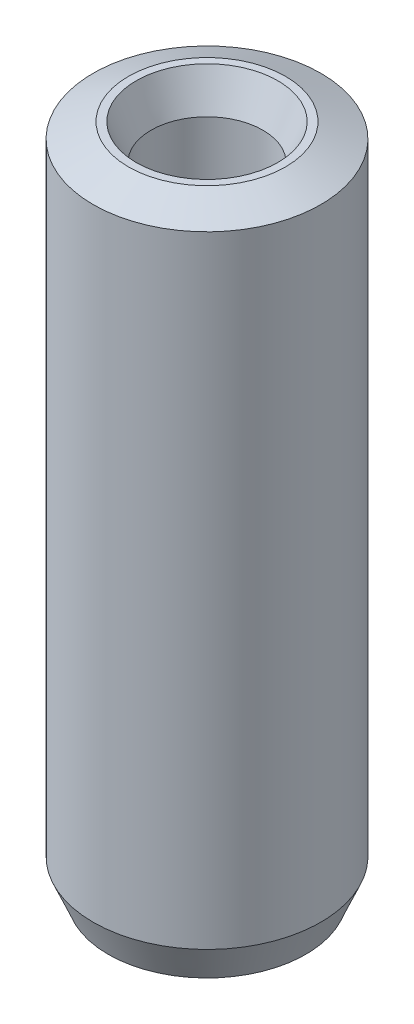
from build123d import *
from OCP.BRepFilletAPI import BRepFilletAPI_MakeChamfer

# Parameters (mm, degrees)
SKETCH1_R           = 5
BOSS_EXTRUDE1_DEPTH = 29.509972501
SKETCH2_R           = 2.455736508
CUT_EXTRUDE1_DEPTH  = 31.345320513
CHAMFER1_SIZE       = 0.657311734
CHAMFER1_SIZE2      = 1.551333462


with BuildPart() as part:
    # Sketch1 → Boss-Extrude1 (new body)
    with BuildSketch(Plane(origin=(0, 0, 0), x_dir=(1, 0, 0), z_dir=(0, 1, 0))):
        Circle(SKETCH1_R)
    extrude(amount=BOSS_EXTRUDE1_DEPTH)

    # Sketch2 → Cut-Extrude1 (cut, through all)
    with BuildSketch(Plane(origin=(0, 0, 0), x_dir=(1, 0, 0), z_dir=(0, 1, 0))):
        Circle(SKETCH2_R)
    extrude(amount=CUT_EXTRUDE1_DEPTH, mode=Mode.SUBTRACT)

    # Chamfer1: one chamfer whose edges measure the first distance from different faces: ONE call of the kernel's chamfer builder (chamfer() names one face for all edges)
    chamfer1_edges_1 = [part.edges().sort_by_distance(p)[0] for p in [
        (-2.455736508, 29.509972501, 0),
    ]]
    chamfer1_side_1 = [part.faces().sort_by_distance(p)[0] for p in [
        (-4.858578644, 29.509972501, 0),
    ]]
    chamfer1_edges_2 = [part.edges().sort_by_distance(p)[0] for p in [
        (-2.455736508, 0, 0),
    ]]
    chamfer1_side_2 = [part.faces().sort_by_distance(p)[0] for p in [
        (-2.455736508, 14.754986251, 0),
    ]]
    chamfer1_edges_3 = [part.edges().sort_by_distance(p)[0] for p in [
        (-5, 0, 0),
    ]]
    chamfer1_side_3 = [part.faces().sort_by_distance(p)[0] for p in [
        (-4.858578644, 0, 0),
    ]]
    chamfer1_edges_4 = [part.edges().sort_by_distance(p)[0] for p in [
        (-5, 29.509972501, 0),
    ]]
    chamfer1_side_4 = [part.faces().sort_by_distance(p)[0] for p in [
        (-5, 14.754986251, 0),
    ]]
    chamfer1 = BRepFilletAPI_MakeChamfer(part.part.solid().wrapped)
    for e in chamfer1_edges_1:
        chamfer1.Add(CHAMFER1_SIZE, CHAMFER1_SIZE2, e.wrapped, chamfer1_side_1[0].wrapped)  # the first distance lies on this face
    for e in chamfer1_edges_2:
        chamfer1.Add(CHAMFER1_SIZE, CHAMFER1_SIZE2, e.wrapped, chamfer1_side_2[0].wrapped)  # the first distance lies on this face
    for e in chamfer1_edges_3:
        chamfer1.Add(CHAMFER1_SIZE, CHAMFER1_SIZE2, e.wrapped, chamfer1_side_3[0].wrapped)  # the first distance lies on this face
    for e in chamfer1_edges_4:
        chamfer1.Add(CHAMFER1_SIZE, CHAMFER1_SIZE2, e.wrapped, chamfer1_side_4[0].wrapped)  # the first distance lies on this face
    add(Compound.cast(chamfer1.Shape()), mode=Mode.REPLACE)


solid = part.part
